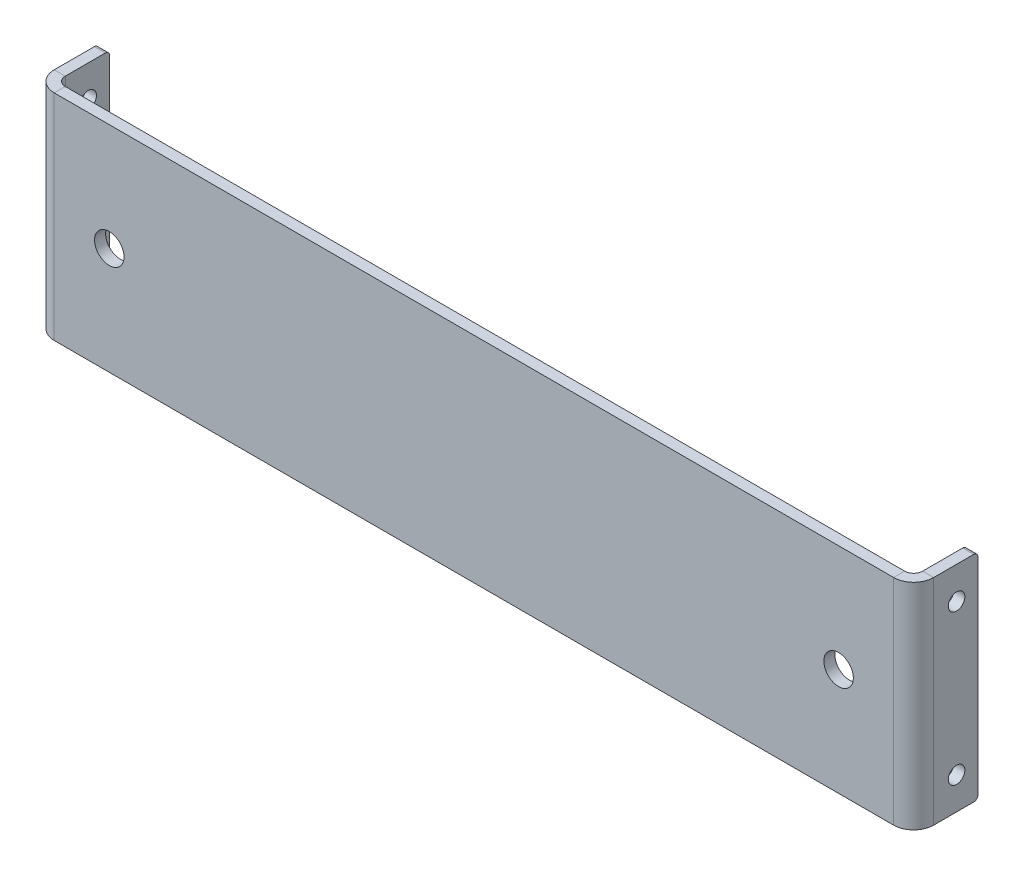
from build123d import *

# Parameters (mm, degrees)
SKETCH1_W                        = 260.35
SKETCH1_H                        = 63.5
BASE_FLANGE1_DEPTH               = 3.2639
EDGE_FLANGE1_STRIP_W             = 18.36928
EDGE_FLANGE1_STRIP_H             = 3.2639
EDGE_FLANGE1_STRIP_CUT_DEPTH     = 63.5
EDGE_FLANGE1_STRIP_2_W           = 18.36928
EDGE_FLANGE1_STRIP_2_H           = 3.2639
EDGE_FLANGE1_STRIP_CUT_2_DEPTH   = 63.5
EDGE_FLANGE1_DEPTH               = 63.5
EDGE_FLANGE1_BEND_DEPTH          = 63.5
F_10_0_1935_DIAMETER_HOLE1_D     = 4.9149
FILLET1_R                        = 1.27
F_11_32_0_34375_DIAMETER_HOLE1_D = 8.73125


# Sheet-metal steps are written as plain solids
with BuildPart() as part:
    # Sketch1 → Base-Flange1 (new body)
    with BuildSketch(Plane.XY):
        Rectangle(SKETCH1_W, SKETCH1_H)
    extrude(amount=-BASE_FLANGE1_DEPTH)

    # Edge-Flange1 strip (across the edge) → Edge-Flange1 strip cut (cut)
    with BuildSketch(Plane(origin=(130.175, 31.75, -3.2639), x_dir=(-1, 0, 0), z_dir=(0, -1, 0))):
        with Locations((-3.2639, -1.63195)):
            Rectangle(EDGE_FLANGE1_STRIP_W, EDGE_FLANGE1_STRIP_H)
    extrude(amount=EDGE_FLANGE1_STRIP_CUT_DEPTH, mode=Mode.SUBTRACT)

    # Edge-Flange1 strip 2 (across the edge) → Edge-Flange1 strip cut 2 (cut)
    with BuildSketch(Plane(origin=(-130.175, -31.75, -3.2639), x_dir=(1, 0, 0), z_dir=(0, 1, 0))):
        with Locations((-3.2639, -1.63195)):
            Rectangle(EDGE_FLANGE1_STRIP_2_W, EDGE_FLANGE1_STRIP_2_H)
    extrude(amount=EDGE_FLANGE1_STRIP_CUT_2_DEPTH, mode=Mode.SUBTRACT)

    # Edge-Flange1 section (across the edge) → Edge-Flange1 (add)
    with BuildSketch(Plane(origin=(130.175, 31.75, -3.2639), x_dir=(-1, 0, 0), z_dir=(0, -1, 0))):
        with BuildLine():
            Line((0, 2.65684), (0, 15.7861))
            Line((0, 15.7861), (3.2639, 15.7861))
            Line((3.2639, 15.7861), (3.2639, 2.65684))
            ThreePointArc((3.2639, 2.65684), (4.042070419, 0.778170419), (5.92074, 0))
            Line((5.92074, 0), (5.92074, -3.2639))
            ThreePointArc((5.92074, -3.2639), (1.734144596, -1.529755404), (0, 2.65684))
        make_face()
    extrude(amount=EDGE_FLANGE1_DEPTH)

    # Edge-Flange1 section 2 (across the edge) → Edge-Flange1 bend (add)
    with BuildSketch(Plane(origin=(-130.175, -31.75, -3.2639), x_dir=(1, 0, 0), z_dir=(0, 1, 0))):
        with BuildLine():
            Line((0, 2.65684), (0, 15.7861))
            Line((0, 15.7861), (3.2639, 15.7861))
            Line((3.2639, 15.7861), (3.2639, 2.65684))
            ThreePointArc((3.2639, 2.65684), (4.042070419, 0.778170419), (5.92074, 0))
            Line((5.92074, 0), (5.92074, -3.2639))
            ThreePointArc((5.92074, -3.2639), (1.734144596, -1.529755404), (0, 2.65684))
        make_face()
    extrude(amount=EDGE_FLANGE1_BEND_DEPTH)

    # #10 (0.1935) Diameter Hole1 (through all)
    with Locations(Plane(origin=(130.175, 0, 0), x_dir=(0, 0, -1), z_dir=(1, 0, 0))):
        with Locations((12.7, 22.225), (12.7, -22.225)):
            Hole(F_10_0_1935_DIAMETER_HOLE1_D / 2)

    # Fillet1
    fillet1_edges = [part.edges().sort_by_distance(p)[0] for p in [
        (128.54305, 31.75, -19.05),
        (128.54305, -31.75, -19.05),
        (-128.54305, -31.75, -19.05),
        (-128.54305, 31.75, -19.05),
    ]]
    fillet(fillet1_edges, radius=FILLET1_R)

    # 11/32 (0.34375) Diameter Hole1 (through all)
    with Locations(Plane.XY):
        with Locations((-107.95, 0), (107.95, 0)):
            Hole(F_11_32_0_34375_DIAMETER_HOLE1_D / 2)


solid = part.part
